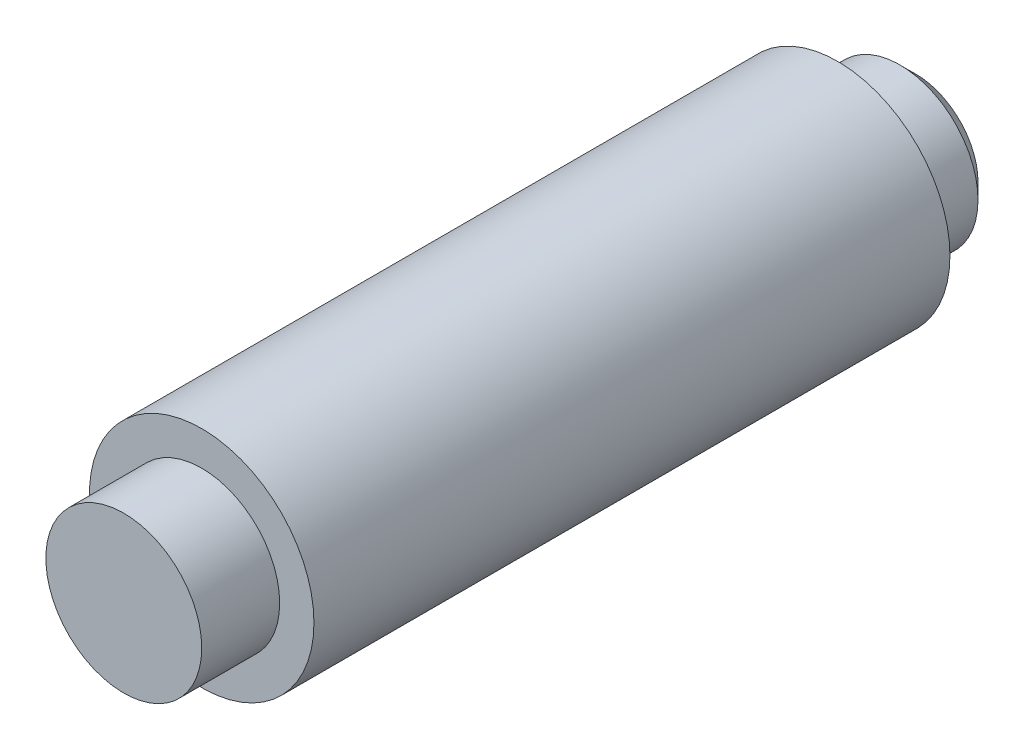
from build123d import *

# Parameters (mm, degrees)
SKETCH3_R           = 3.6
BOSS_EXTRUDE1_DEPTH = 20.4
SKETCH4_R           = 2.5
BOSS_EXTRUDE2_DEPTH = 2.5
BOSS_EXTRUDE3_START = 2.5
SKETCH5_R           = 2.5
BOSS_EXTRUDE3_DEPTH = 2.5
CHAMFER1_SIZE       = 0.5


with BuildPart() as part:
    # Sketch3 → Boss-Extrude1 (new body)
    with BuildSketch(Plane.XY):
        Circle(SKETCH3_R)
    extrude(amount=BOSS_EXTRUDE1_DEPTH)

    # Sketch4 → Boss-Extrude2 (add)
    with BuildSketch(Plane.XY):
        Circle(SKETCH4_R)
    extrude(amount=-BOSS_EXTRUDE2_DEPTH)

    # Sketch5 → Boss-Extrude3 (add)
    with BuildSketch(Plane.XY.offset(20.4).offset(BOSS_EXTRUDE3_START)):
        Circle(SKETCH5_R)
    extrude(amount=-BOSS_EXTRUDE3_DEPTH)

    # Chamfer1
    chamfer1_edges = [part.edges().sort_by_distance(p)[0] for p in [
        (-2.5, 0, -2.5),
    ]]
    chamfer(chamfer1_edges, length=CHAMFER1_SIZE)


solid = part.part
